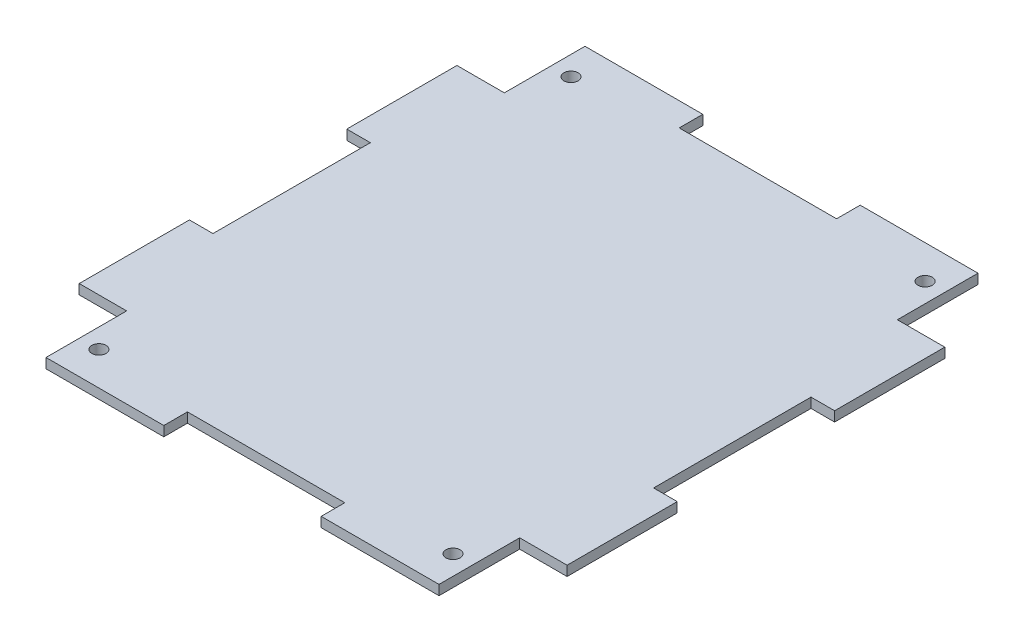
from build123d import *

# Parameters (mm, degrees)
SKETCH1_R           = 2.286
BOSS_EXTRUDE1_DEPTH = 3.175


with BuildPart() as part:
    # Sketch1 → Boss-Extrude1 (new body)
    with BuildSketch(Plane(origin=(0, 0, 0), x_dir=(1, 0, 0), z_dir=(0, 1, 0))):
        Polygon((-25.4, 86.995), (-63.43142, 86.995), (-63.43142, 60.96), (-78.74, 60.96), (-78.74, 25.4), (-71.12, 25.4), (-71.12, -25.4), (-78.74, -25.4), (-78.74, -60.96), (-63.43142, -60.96), (-63.43142, -86.995), (-25.4, -86.995), (-25.4, -79.375), (25.4, -79.375), (25.4, -86.995), (63.43142, -86.995), (63.43142, -60.96), (78.74, -60.96), (78.74, -25.4), (71.12, -25.4), (71.12, 25.4), (78.74, 25.4), (78.74, 60.96), (63.43142, 60.96), (63.43142, 86.995), (25.4, 86.995), (25.4, 79.375), (-25.4, 79.375), align=None)
        with Locations((-57.15, 76.2)):
            Circle(SKETCH1_R, mode=Mode.SUBTRACT)
        with Locations((57.15, 76.2)):
            Circle(SKETCH1_R, mode=Mode.SUBTRACT)
        with Locations((57.15, -76.2)):
            Circle(SKETCH1_R, mode=Mode.SUBTRACT)
        with Locations((-57.15, -76.2)):
            Circle(SKETCH1_R, mode=Mode.SUBTRACT)
    extrude(amount=BOSS_EXTRUDE1_DEPTH)


solid = part.part
